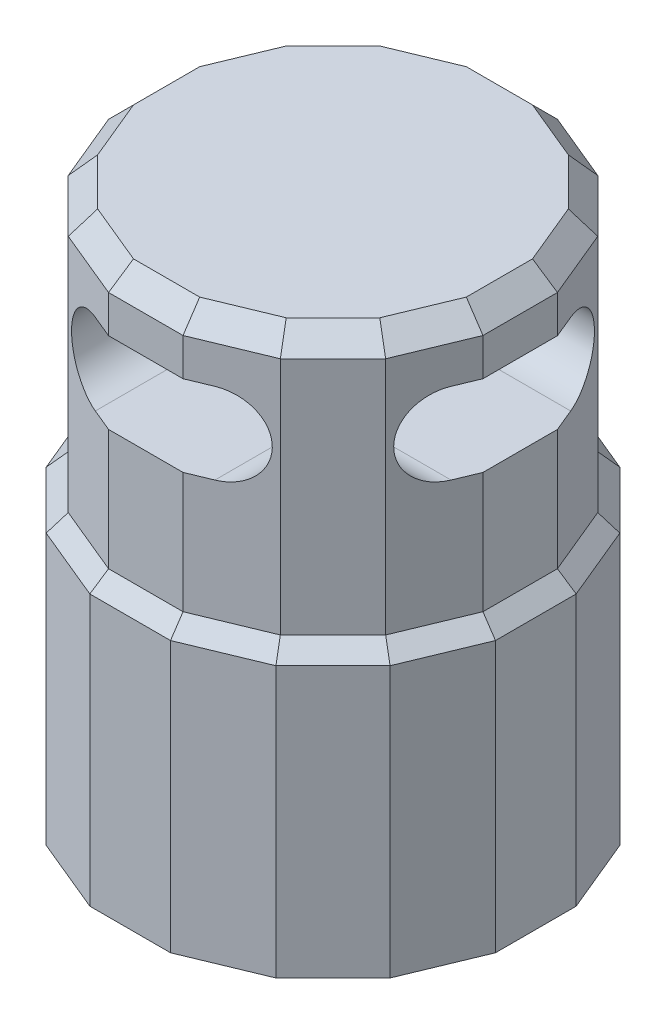
from build123d import *

# Parameters (mm, degrees)
BOSS_EXTRUDE1_DEPTH            = 50
BOSS_EXTRUDE2_DEPTH            = 55
CHAMFER1_SIZE                  = 4
CHAMFER3_SIZE                  = 3
CUT_EXTRUDE1_REACH             = 79.891
CUT_EXTRUDE1_DIRECTION_2_REACH = 79.891
CUT_EXTRUDE2_REACH             = 79.891
CUT_EXTRUDE2_DIRECTION_2_REACH = 79.891


with BuildPart() as part:
    # Sketch1 → Boss-Extrude1 (new body)
    with BuildSketch(Plane(origin=(0, 0, 0), x_dir=(1, 0, 0), z_dir=(0, 1, 0))):
        Polygon((36, 7.160845226), (30.519326341, 20.392361905), (20.392361905, 30.519326341), (7.160845226, 36), (-7.160845226, 36), (-20.392361905, 30.519326341), (-30.519326341, 20.392361905), (-36, 7.160845226), (-36, -7.160845226), (-30.519326341, -20.392361905), (-20.392361905, -30.519326341), (-7.160845226, -36), (7.160845226, -36), (20.392361905, -30.519326341), (30.519326341, -20.392361905), (36, -7.160845226), align=None)
    extrude(amount=BOSS_EXTRUDE1_DEPTH)

    # Sketch2 → Boss-Extrude2 (add)
    with BuildSketch(Plane.XZ):
        Polygon((33.062603536, 22.091725397), (22.091725397, 33.062603536), (7.757582328, 39), (-7.757582328, 39), (-22.091725397, 33.062603536), (-33.062603536, 22.091725397), (-39, 7.757582328), (-39, -7.757582328), (-33.062603536, -22.091725397), (-22.091725397, -33.062603536), (-7.757582328, -39), (7.757582328, -39), (22.091725397, -33.062603536), (33.062603536, -22.091725397), (39, -7.757582328), (39, 7.757582328), align=None)
    extrude(amount=BOSS_EXTRUDE2_DEPTH)

    # Chamfer1
    chamfer1_edges = [part.edges().sort_by_distance(p)[0] for p in [
        (25.455844123, 50, -25.455844123),
        (13.776603565, 50, -33.25966317),
        (0, 50, -36),
        (-13.776603565, 50, -33.25966317),
        (-25.455844123, 50, -25.455844123),
        (-33.25966317, 50, -13.776603565),
        (-36, 50, 0),
        (-33.25966317, 50, 13.776603565),
        (-25.455844123, 50, 25.455844123),
        (-13.776603565, 50, 33.25966317),
        (36, 50, 0),
        (0, 50, 36),
        (13.776603565, 50, 33.25966317),
        (25.455844123, 50, 25.455844123),
        (33.25966317, 50, 13.776603565),
        (33.25966317, 50, -13.776603565),
    ]]
    chamfer(chamfer1_edges, length=CHAMFER1_SIZE)

    # Chamfer3
    chamfer3_edges = [part.edges().sort_by_distance(p)[0] for p in [
        (36.031301768, 0, 14.924653862),
        (27.577164466, 0, 27.577164466),
        (14.924653862, 0, 36.031301768),
        (0, 0, 39),
        (-14.924653862, 0, 36.031301768),
        (-27.577164466, 0, 27.577164466),
        (-36.031301768, 0, 14.924653862),
        (-39, 0, 0),
        (-36.031301768, 0, -14.924653862),
        (-27.577164466, 0, -27.577164466),
        (-14.924653862, 0, -36.031301768),
        (0, 0, -39),
        (14.924653862, 0, -36.031301768),
        (27.577164466, 0, -27.577164466),
        (36.031301768, 0, -14.924653862),
        (39, 0, 0),
    ]]
    chamfer(chamfer3_edges, length=CHAMFER3_SIZE - 0.0001)  # a hair under: the kernel refuses the full size

    # Cut-Extrude1: up to this face of the body (flat: up to its plane)
    cut_extrude1_end = Plane(part.part.faces().sort_by_distance((0, 23, -36))[0])
    # Sketch3 → Cut-Extrude1 (cut, up to the picked face)
    with BuildSketch(Plane.XY, mode=Mode.PRIVATE) as cut_extrude1_sk1:
        with BuildLine():
            Line((-11.5, 38.8), (11.5, 38.8))
            ThreePointArc((11.5, 38.8), (19.3, 31), (11.5, 23.2))
            Line((11.5, 23.2), (-11.5, 23.2))
            ThreePointArc((-11.5, 23.2), (-19.3, 31), (-11.5, 38.8))
        make_face()
    cut_extrude1_tool1 = split(extrude(cut_extrude1_sk1.sketch, amount=-CUT_EXTRUDE1_REACH, mode=Mode.PRIVATE), bisect_by=cut_extrude1_end, keep=Keep.BOTH, mode=Mode.PRIVATE)
    add(cut_extrude1_tool1.solids().sort_by(Axis((0, 31, 0), (0, 0, -1)))[0], mode=Mode.SUBTRACT)

    # Cut-Extrude1 direction 2: up to this face of the body (flat: up to its plane)
    cut_extrude1_direction_2_end = Plane(part.part.faces().sort_by_distance((0, 23, 36))[0])
    # Sketch3 → Cut-Extrude1 direction 2 (cut, up to the picked face)
    with BuildSketch(Plane.XY, mode=Mode.PRIVATE) as cut_extrude1_direction_2_sk1:
        with BuildLine():
            Line((-11.5, 38.8), (11.5, 38.8))
            ThreePointArc((11.5, 38.8), (19.3, 31), (11.5, 23.2))
            Line((11.5, 23.2), (-11.5, 23.2))
            ThreePointArc((-11.5, 23.2), (-19.3, 31), (-11.5, 38.8))
        make_face()
    cut_extrude1_direction_2_tool1 = split(extrude(cut_extrude1_direction_2_sk1.sketch, amount=CUT_EXTRUDE1_DIRECTION_2_REACH, mode=Mode.PRIVATE), bisect_by=cut_extrude1_direction_2_end, keep=Keep.BOTH, mode=Mode.PRIVATE)
    add(cut_extrude1_direction_2_tool1.solids().sort_by(Axis((0, 31, 0), (0, 0, 1)))[0], mode=Mode.SUBTRACT)

    # Cut-Extrude2: up to this face of the body (flat: up to its plane)
    cut_extrude2_end = Plane(part.part.faces().sort_by_distance((36, 23, 0))[0])
    # Sketch4 → Cut-Extrude2 (cut, up to the picked face)
    with BuildSketch(Plane(origin=(0, 0, 0), x_dir=(0, 0, -1), z_dir=(1, 0, 0)), mode=Mode.PRIVATE) as cut_extrude2_sk1:
        with BuildLine():
            Line((-11.5, 38.8), (11.5, 38.8))
            ThreePointArc((11.5, 38.8), (19.3, 31), (11.5, 23.2))
            Line((11.5, 23.2), (-11.5, 23.2))
            ThreePointArc((-11.5, 23.2), (-19.3, 31), (-11.5, 38.8))
        make_face()
    cut_extrude2_tool1 = split(extrude(cut_extrude2_sk1.sketch, amount=CUT_EXTRUDE2_REACH, mode=Mode.PRIVATE), bisect_by=cut_extrude2_end, keep=Keep.BOTH, mode=Mode.PRIVATE)
    add(cut_extrude2_tool1.solids().sort_by(Axis((0, 31, 0), (1, 0, 0)))[0], mode=Mode.SUBTRACT)

    # Cut-Extrude2 direction 2: up to this face of the body (flat: up to its plane)
    cut_extrude2_direction_2_end = Plane(part.part.faces().sort_by_distance((-36, 23, 0))[0])
    # Sketch4 → Cut-Extrude2 direction 2 (cut, up to the picked face)
    with BuildSketch(Plane(origin=(0, 0, 0), x_dir=(0, 0, -1), z_dir=(1, 0, 0)), mode=Mode.PRIVATE) as cut_extrude2_direction_2_sk1:
        with BuildLine():
            Line((-11.5, 38.8), (11.5, 38.8))
            ThreePointArc((11.5, 38.8), (19.3, 31), (11.5, 23.2))
            Line((11.5, 23.2), (-11.5, 23.2))
            ThreePointArc((-11.5, 23.2), (-19.3, 31), (-11.5, 38.8))
        make_face()
    cut_extrude2_direction_2_tool1 = split(extrude(cut_extrude2_direction_2_sk1.sketch, amount=-CUT_EXTRUDE2_DIRECTION_2_REACH, mode=Mode.PRIVATE), bisect_by=cut_extrude2_direction_2_end, keep=Keep.BOTH, mode=Mode.PRIVATE)
    add(cut_extrude2_direction_2_tool1.solids().sort_by(Axis((0, 31, 0), (-1, 0, 0)))[0], mode=Mode.SUBTRACT)


solid = part.part
